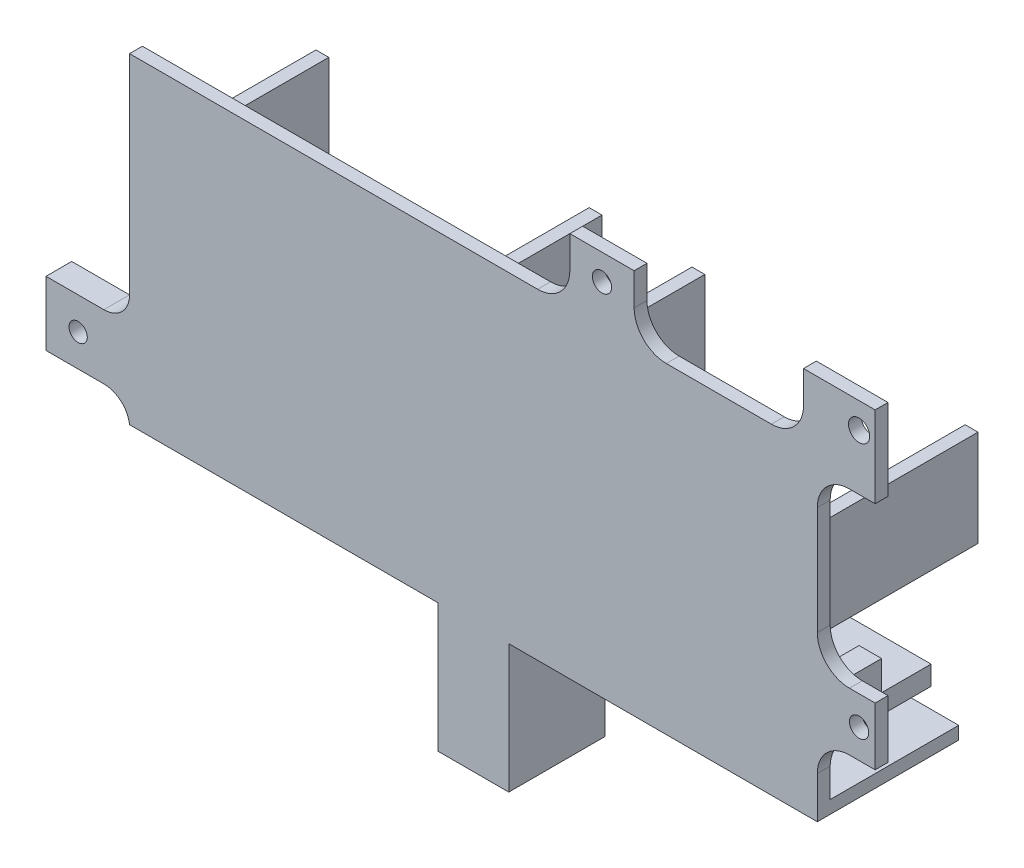
from build123d import *

# Parameters (mm, degrees)
SKETCH1_W            = 50
SKETCH1_H            = 50
BOSS_EXTRUDE1_DEPTH  = 2
SKETCH2_W            = 8.5
SKETCH2_H            = 2
SKETCH2_W_2          = 25.5
BOSS_EXTRUDE2_DEPTH  = 20
SKETCH3_W            = 2
SKETCH3_H            = 15
BOSS_EXTRUDE3_DEPTH  = 20
SKETCH5_W            = 2
SKETCH5_H            = 15
BOSS_EXTRUDE5_DEPTH  = 25
SKETCH8_W            = 3.5
SKETCH8_H            = 6
BOSS_EXTRUDE7_DEPTH  = 8
BOSS_EXTRUDE8_DEPTH  = 3.5
SKETCH10_W           = 9
SKETCH10_H           = 9
SKETCH10_R           = 1.5
SKETCH10_R_2         = 1.65
SKETCH10_W_2         = 10
SKETCH10_H_2         = 10
BOSS_EXTRUDE9_DEPTH  = 2
FILLET1_R            = 5
SKETCH11_W           = 17
SKETCH11_H           = 3
BOSS_EXTRUDE10_DEPTH = 19
FILLET2_R            = 1.5
SKETCH12_W           = 13
SKETCH12_H           = 10
BOSS_EXTRUDE11_DEPTH = 4
FILLET3_START        = -2
FILLET3_DEPTH        = 4
FILLET3_START_2      = -20
FILLET3_2_DEPTH      = 18.41096
FILLET3_3_DEPTH      = 2
SKETCH13_R           = 1.425
CUT_EXTRUDE1_DEPTH   = 105.091306073
FILLET4_START        = -2.000000956
FILLET4_DEPTH        = 4.000000956
FILLET4_START_2      = -30
FILLET4_2_DEPTH      = 5


with BuildPart() as part:
    # Sketch1 → Boss-Extrude1 (new body)
    with BuildSketch(Plane.XY):
        Rectangle(SKETCH1_W, SKETCH1_H)
    extrude(amount=BOSS_EXTRUDE1_DEPTH)

    # Sketch2 → Boss-Extrude2 (add)
    with BuildSketch(Plane(origin=(0, 0, 0), x_dir=(-1, 0, 0), z_dir=(0, 0, -1))):
        with Locations((-20.75, -24)):
            Rectangle(SKETCH2_W, SKETCH2_H)
        with Locations((12.25, -24)):
            Rectangle(SKETCH2_W_2, SKETCH2_H)
    extrude(amount=BOSS_EXTRUDE2_DEPTH)

    # Sketch3 → Boss-Extrude3 (add)
    with BuildSketch(Plane.XZ.offset(25)):
        with Locations((24, -5.5)):
            Rectangle(SKETCH3_W, SKETCH3_H)
    extrude(amount=BOSS_EXTRUDE3_DEPTH)

    # Sketch5 → Boss-Extrude5 (add)
    with BuildSketch(Plane(origin=(0, 0, 0), x_dir=(-1, 0, 0), z_dir=(0, 0, -1))):
        with Locations((-20.5, 5.5)):
            Rectangle(SKETCH5_W, SKETCH5_H)
        with Locations((22, 5.5)):
            Rectangle(SKETCH5_W, SKETCH5_H)
    extrude(amount=BOSS_EXTRUDE5_DEPTH)

    # Sketch8 → Boss-Extrude7 (add)
    with BuildSketch(Plane(origin=(0, 0, 0), x_dir=(-1, 0, 0), z_dir=(0, 0, -1))):
        with Locations((23.25, -11)):
            Rectangle(SKETCH8_W, SKETCH8_H)
    extrude(amount=BOSS_EXTRUDE7_DEPTH)

    # Sketch9 → Boss-Extrude8 (add)
    with BuildSketch(Plane(origin=(25, 0, 0), x_dir=(0, 0, -1), z_dir=(1, 0, 0))):
        Polygon((-2, 25), (0, 25), (0, -23), (20, -23), (20, -25), (13, -25), (13, -45), (-2, -45), align=None)
    extrude(amount=BOSS_EXTRUDE8_DEPTH)

    # Mirror1: part across plane


with BuildPart() as part_1:
    add(part.part)
    add(part.part.mirror(Plane.ZY.offset(-28.5)))

    # Sketch10 → Boss-Extrude9 (add)
    # profile 1 of 3: a face of its own
    with BuildSketch(Plane(origin=(0, 0, 0), x_dir=(-1, 0, 0), z_dir=(0, 0, -1))):
        with Locations((-86.5, -9)):
            Rectangle(SKETCH10_W, SKETCH10_H)
        with Locations((-88.5, -9)):
            Circle(SKETCH10_R, mode=Mode.SUBTRACT)
    # profile 2 of 3: a face of its own
    with BuildSketch(Plane(origin=(0, 0, 0), x_dir=(-1, 0, 0), z_dir=(0, 0, -1))):
        Polygon((-79.85, 35), (-79.85, 25), (-82, 25), (-82, 22.35), (-91, 22.35), (-91, 35), align=None)
        with Locations((-88.5, 31)):
            Circle(SKETCH10_R_2, mode=Mode.SUBTRACT)
    # profile 3 of 3: a face of its own
    with BuildSketch(Plane(origin=(0, 0, 0), x_dir=(-1, 0, 0), z_dir=(0, 0, -1))):
        with Locations((-48.5, 30)):
            Rectangle(SKETCH10_W_2, SKETCH10_H_2)
        with Locations((-48.5, 31)):
            Circle(SKETCH10_R, mode=Mode.SUBTRACT)
    extrude(amount=-BOSS_EXTRUDE9_DEPTH)

    # Fillet1
    # the kernel refuses this fillet: 5 mm, written as the material it adds along each edge
    with BuildSketch(Plane(origin=(82, -4.5, 0), x_dir=(0, 1, 0), z_dir=(0, 0, 1)), Plane(origin=(79.85, 25, 0), x_dir=(-1, 0, 0), z_dir=(0, 0, 1)), Plane(origin=(43.5, 25, 0), x_dir=(-1, 0, 0), z_dir=(0, 0, 1))) as fillet1_piece_1:
        with BuildLine():
            CenterArc((FILLET1_R, -FILLET1_R), FILLET1_R, 90, 90)
            Line((0, -FILLET1_R), (0, 0))
            Line((0, 0), (FILLET1_R, 0))
        make_face()
    extrude(amount=2)
    with BuildSketch(Plane(origin=(82, -13.5, 0), x_dir=(0, -1, 0), z_dir=(0, 0, 1)), Plane(origin=(82, 22.35, 0), x_dir=(0, -1, 0), z_dir=(0, 0, 1)), Plane(origin=(53.5, 25, 0), x_dir=(1, 0, 0), z_dir=(0, 0, 1))) as fillet1_piece_2:
        with BuildLine():
            CenterArc((FILLET1_R, FILLET1_R), FILLET1_R, 180, 90)
            Line((0, FILLET1_R), (0, 0))
            Line((0, 0), (FILLET1_R, 0))
        make_face()
    extrude(amount=2)

    # Sketch11 → Boss-Extrude10 (add)
    with BuildSketch(Plane(origin=(0, 0, 0), x_dir=(-1, 0, 0), z_dir=(0, 0, -1))):
        with Locations((-70.2, -17.4)):
            Rectangle(SKETCH11_W, SKETCH11_H)
        with Locations((12.5, -17.4)):
            Rectangle(SKETCH11_W, SKETCH11_H)
    extrude(amount=BOSS_EXTRUDE10_DEPTH)

    # Fillet2
    fillet2_edges = [part_1.edges().sort_by_distance(p)[0] for p in [
        (79, 13, 0),
        (79, -2, 0),
        (80, 5.5, 0),
        (36.5, 13, 0),
        (35.5, 5.5, 0),
        (36.5, -2, 0),
        (20.5, 13, 0),
        (20.5, -2, 0),
        (21.5, 5.5, 0),
        (-22, 13, 0),
        (-23, 5.5, 0),
        (-22, -2, 0),
    ]]
    fillet(fillet2_edges, radius=FILLET2_R)

    # Sketch12 → Boss-Extrude11 (add)
    with BuildSketch(Plane.XY.offset(2)):
        with Locations((-31.5, -16.5)):
            Rectangle(SKETCH12_W, SKETCH12_H)
    extrude(amount=-BOSS_EXTRUDE11_DEPTH)

    # Fillet3: read off the stored shape, not the designer's step
    # Fillet3 outline → Fillet3 (add)
    with BuildSketch(Plane.XY.offset(FILLET3_START)):
        with BuildLine():
            ThreePointArc((-25.846127967, -23), (-25.284740857, -23.941480467), (-25, -25))
            Line((-25, -25), (-25, -23))
            Line((-25, -23), (-25.846127967, -23))
        make_face()
        with BuildLine():
            ThreePointArc((-25.031373033, -8), (-26.354248689, -10.5), (-29, -11.5))
            Line((-29, -11.5), (-25, -11.5))
            Line((-25, -11.5), (-25, -8))
            Line((-25, -8), (-25.031373033, -8))
        make_face()
    extrude(amount=FILLET3_DEPTH)

    # Fillet3 2 outline → Fillet3 2 (add)
    with BuildSketch(Plane.XY.offset(FILLET3_START_2)):
        with BuildLine():
            ThreePointArc((-25.846127967, -23), (-25.284740857, -23.941480467), (-25, -25))
            Line((-25, -25), (-25, -23))
            Line((-25, -23), (-25.846127967, -23))
        make_face()
    extrude(amount=FILLET3_2_DEPTH)

    # Fillet3 3 outline → Fillet3 3 (add)
    with BuildSketch(Plane.XY):
        with BuildLine():
            ThreePointArc((-28.968626967, -21.5), (-27.236576159, -21.894448725), (-25.846127967, -23))
            Line((-25.846127967, -23), (-25, -23))
            Line((-25, -23), (-25, -21.5))
            Line((-25, -21.5), (-28.968626967, -21.5))
        make_face()
        with BuildLine():
            ThreePointArc((-25, -7.5), (-25.007850963, -7.75049165), (-25.031373033, -8))
            Line((-25.031373033, -8), (-25, -8))
            Line((-25, -8), (-25, -7.5))
        make_face()
    extrude(amount=FILLET3_3_DEPTH)

    # Sketch13 → Cut-Extrude1 (cut, through all)
    with BuildSketch(Plane(origin=(0, 0, -2), x_dir=(-1, 0, 0), z_dir=(0, 0, -1))):
        with Locations((33, -16.5)):
            Circle(SKETCH13_R)
    extrude(amount=-CUT_EXTRUDE1_DEPTH, mode=Mode.SUBTRACT)

    # Fillet4: read off the stored shape, not the designer's step
    # Fillet4 outline → Fillet4 (add)
    with BuildSketch(Plane.XY.offset(FILLET4_START)):
        with BuildLine():
            Line((-25.846127967, -23), (-25, -23))
            Line((-25, -23), (-25, -21.5))
            Line((-25, -21.5), (-28.968626967, -21.5))
            ThreePointArc((-28.968626967, -21.5), (-27.236576159, -21.894448725), (-25.846127967, -23))
        make_face()
    extrude(amount=FILLET4_DEPTH)

    # Fillet4 2 outline → Fillet4 2 (cut)
    with BuildSketch(Plane.YZ.offset(FILLET4_START_2)):
        with BuildLine():
            ThreePointArc((-21.499991299, -2.000015071), (-22.150318116, -1.157004674), (-23, -0.515418986))
            Line((-23, -0.515418986), (-23, -2.000000956))
            Line((-23, -2.000000956), (-21.499991299, -2.000015071))
        make_face()
    extrude(amount=FILLET4_2_DEPTH, mode=Mode.SUBTRACT)


solid = part_1.part
